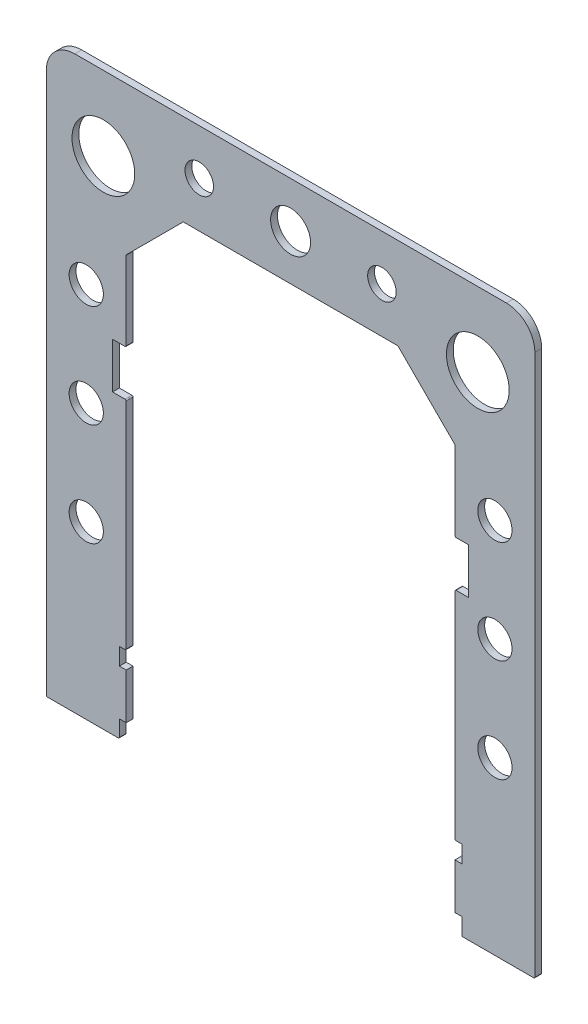
from build123d import *

# Parameters (mm, degrees)
TOWER_DEPTH = 6
SKETCH2_W   = 6
SKETCH2_H   = 15
SKETCH2_W_2 = 12
SKETCH2_H_2 = 40
MOUNT_DEPTH = 615.979674461
FILLET_2_R  = 1
SKETCH3_R   = 12.5
SKETCH3_R_2 = 17.5
SKETCH3_R_3 = 27.5
SKETCH3_R_4 = 15
LITE_DEPTH  = 615.979674461
FILLET2_R   = 25


with BuildPart() as part:
    # Sketch1 → tower (new body)
    with BuildSketch(Plane.XY):
        Polygon((0, 0), (-70, 0), (-70, 500), (358, 500), (358, 0), (288, 0), (288, 370), (238, 420), (50, 420), (0, 370), align=None)
    extrude(amount=-TOWER_DEPTH)

    # Sketch2 → mount (cut, through all)
    with BuildSketch(Plane.XY):
        with Locations((-3, 62.5)):
            Rectangle(SKETCH2_W, SKETCH2_H)
        with Locations((-3, 7.5)):
            Rectangle(SKETCH2_W, SKETCH2_H)
        with Locations((291, 7.5)):
            Rectangle(SKETCH2_W, SKETCH2_H)
        with Locations((291, 62.5)):
            Rectangle(SKETCH2_W, SKETCH2_H)
        with Locations((-6, 280)):
            Rectangle(SKETCH2_W_2, SKETCH2_H_2)
        with Locations((294, 280)):
            Rectangle(SKETCH2_W_2, SKETCH2_H_2)
    extrude(amount=-MOUNT_DEPTH, mode=Mode.SUBTRACT)

    # fillet 2
    fillet_2_edges = [part.edges().sort_by_distance(p)[0] for p in [
        (288, 70, -3),
        (-6, 0, -3),
        (358, 0, -3),
        (294, 0, -3),
        (0, 70, -3),
        (-70, 0, -3),
        (288, 370, -3),
        (238, 420, -3),
        (50, 420, -3),
        (0, 370, -3),
        (288, 260, -3),
        (288, 300, -3),
        (0, 260, -3),
        (0, 300, -3),
    ]]
    fillet(fillet_2_edges, radius=FILLET_2_R)

    # Sketch3 → lite (cut, through all)
    with BuildSketch(Plane.XY):
        with Locations((64, 460)):
            Circle(SKETCH3_R)
        with Locations((144, 460)):
            Circle(SKETCH3_R_2)
        with Locations((224, 460)):
            Circle(SKETCH3_R)
        with Locations((-20, 435)):
            Circle(SKETCH3_R_3)
        with Locations((308, 435)):
            Circle(SKETCH3_R_3)
        with Locations((-35, 330)):
            Circle(SKETCH3_R_4)
        with Locations((-35, 240)):
            Circle(SKETCH3_R_4)
        with Locations((-35, 150)):
            Circle(SKETCH3_R_4)
        with Locations((323, 330)):
            Circle(SKETCH3_R_4)
        with Locations((323, 240)):
            Circle(SKETCH3_R_4)
        with Locations((323, 150)):
            Circle(SKETCH3_R_4)
    extrude(amount=-LITE_DEPTH, mode=Mode.SUBTRACT)

    # fillet2
    fillet2_edges = [part.edges().sort_by_distance(p)[0] for p in [
        (358, 500, -3),
        (-70, 500, -3),
    ]]
    fillet(fillet2_edges, radius=FILLET2_R)


solid = part.part
